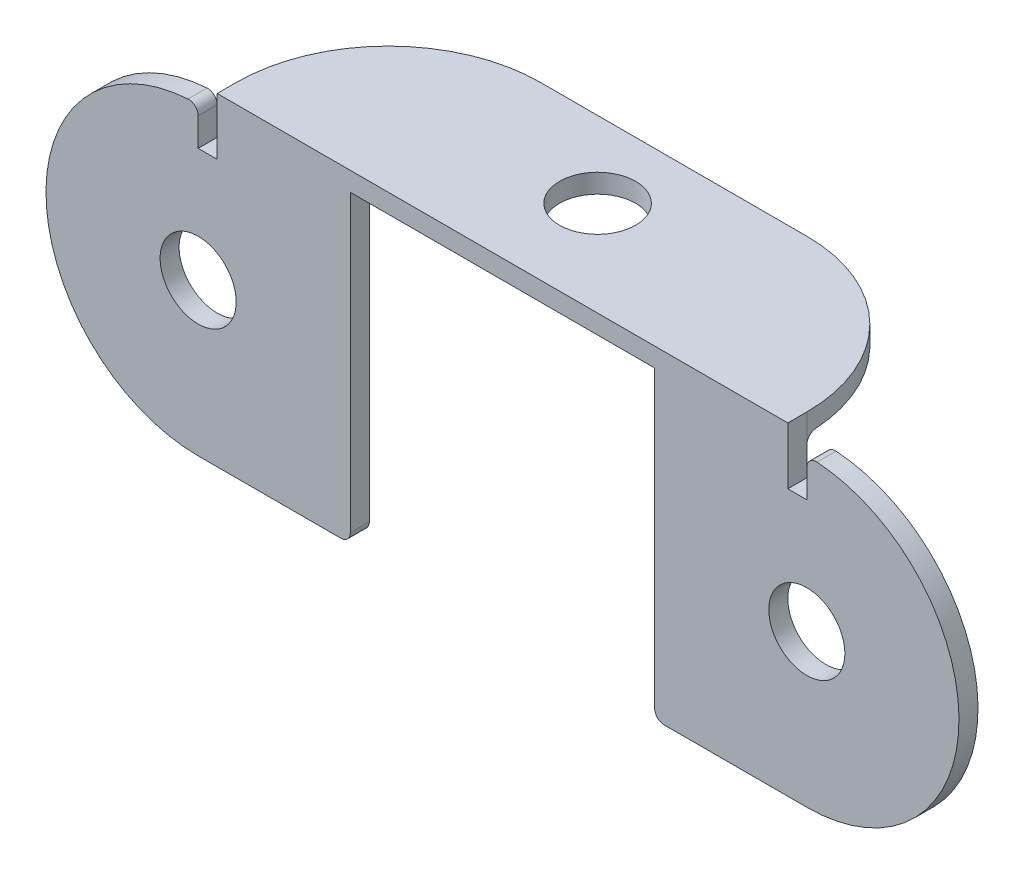
from build123d import *

# Parameters (mm, degrees)
SKETCH1_R               = 3.175
BOSS_EXTRUDE1_DEPTH     = 1.5875
SKETCH3_W               = 50.8
SKETCH3_H               = 12.7
SKETCH3_R               = 3.175
BOSS_EXTRUDE2_DEPTH     = 1.5875
CUT_EXTRUDE1_DEPTH      = 44.12627172
CUT_EXTRUDE1_DEPTH_BACK = 44.12627172
SKETCH5_W               = 1.5875
SKETCH5_H               = 4.7625
FILLET2_R               = 0.79375
FILLET3_R               = 12.7


with BuildPart() as part:
    # Sketch1 → Boss-Extrude1 (new body)
    with BuildSketch(Plane.XY):
        with BuildLine():
            Line((-25.4, -12.7), (-12.7, -12.7))
            Line((-12.7, -12.7), (-12.7, 12.7))
            Line((-12.7, 12.7), (12.7, 12.7))
            Line((12.7, 12.7), (12.7, -12.7))
            Line((12.7, -12.7), (25.4, -12.7))
            ThreePointArc((25.4, -12.7), (38.1, 0), (25.4, 12.7))
            Line((25.4, 12.7), (25.4, 14.2875))
            Line((25.4, 14.2875), (-25.4, 14.2875))
            Line((-25.4, 14.2875), (-25.4, 12.7))
            ThreePointArc((-25.4, 12.7), (-38.1, 0), (-25.4, -12.7))
        make_face()
        with Locations((-25.4, 0)):
            Circle(SKETCH1_R, mode=Mode.SUBTRACT)
        with Locations((25.4, 0)):
            Circle(SKETCH1_R, mode=Mode.SUBTRACT)
    extrude(amount=BOSS_EXTRUDE1_DEPTH)

    # Sketch3 → Boss-Extrude2 (add)
    with BuildSketch(Plane(origin=(0, 14.2875, 0), x_dir=(1, 0, 0), z_dir=(0, 1, 0))):
        with Locations((0, 6.35)):
            Rectangle(SKETCH3_W, SKETCH3_H)
        with Locations(Location((0, 6.35, 0), (0, 0, 270))):
            Circle(SKETCH3_R, mode=Mode.SUBTRACT)
    extrude(amount=-BOSS_EXTRUDE2_DEPTH)

    # Sketch5 → Cut-Extrude1 (cut, two sides: drawn at the far end of the back side and taken through both)
    with BuildSketch(Plane.XY.offset(1.5875).offset(-CUT_EXTRUDE1_DEPTH_BACK)):
        with Locations((-24.60625, 11.90625)):
            Rectangle(SKETCH5_W, SKETCH5_H)
        with Locations((24.60625, 11.90625)):
            Rectangle(SKETCH5_W, SKETCH5_H)
    extrude(amount=CUT_EXTRUDE1_DEPTH + CUT_EXTRUDE1_DEPTH_BACK, mode=Mode.SUBTRACT)

    # Fillet2
    fillet2_edges = [part.edges().sort_by_distance(p)[0] for p in [
        (-12.7, -12.7, 0.79375),
        (-25.4, 12.7, 0.79375),
        (25.4, 12.7, 0.79375),
        (12.7, -12.7, 0.79375),
        (18.25625, 12.7, 0),
        (-18.25625, 12.7, 0),
    ]]
    fillet(fillet2_edges, radius=FILLET2_R)

    # Fillet3
    fillet3_edges = [part.edges().sort_by_distance(p)[0] for p in [
        (23.8125, 13.49375, -12.7),
        (-23.8125, 13.49375, -12.7),
    ]]
    fillet(fillet3_edges, radius=FILLET3_R - 0.0001)  # a hair under: the kernel refuses the full size


solid = part.part
